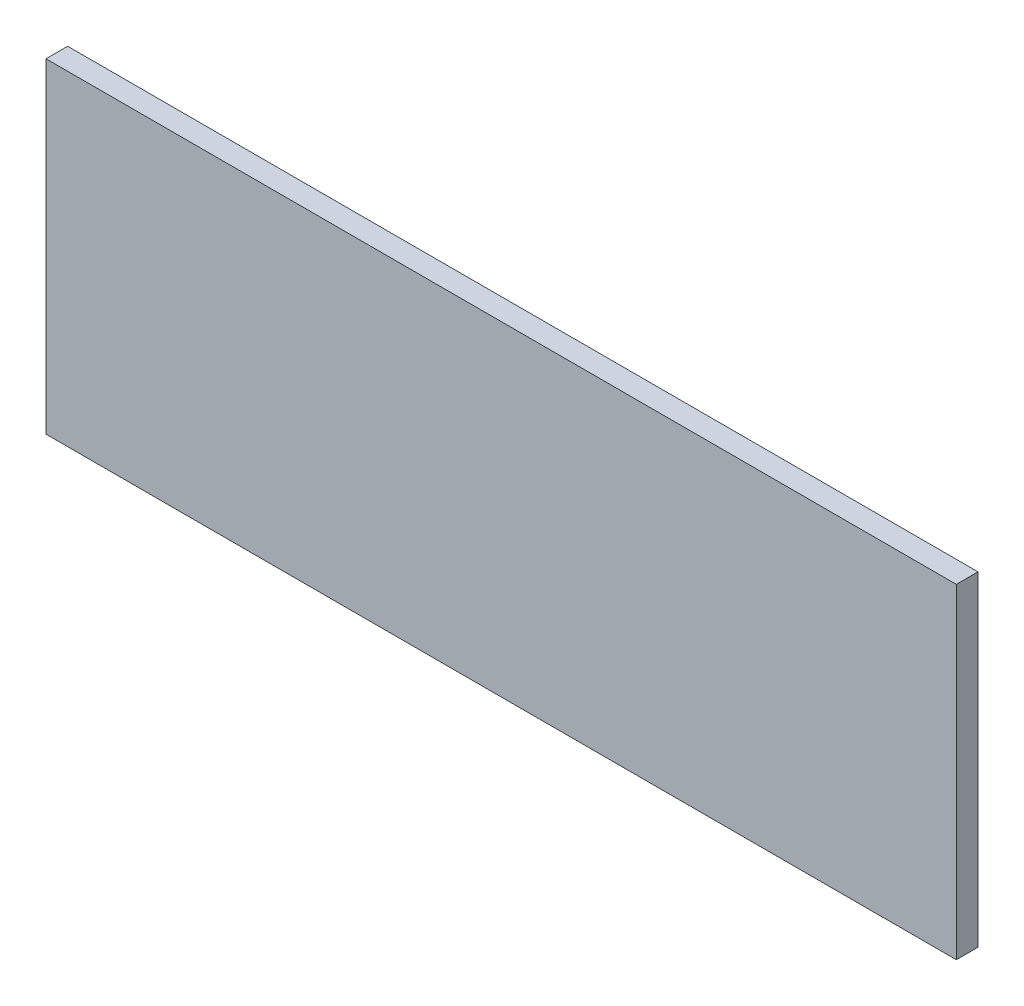
from build123d import *

# Parameters (mm, degrees)
SKETCH_1_W      = 420
SKETCH_1_H      = 150
EXTRUDE_1_DEPTH = 10


with BuildPart() as part:
    # ｽｹｯﾁ1 → ﾎﾞｽ - 押し出し1 (new body)
    with BuildSketch(Plane.XY):
        with Locations((140.719868277, 86.507142857)):
            Rectangle(SKETCH_1_W, SKETCH_1_H)
    extrude(amount=EXTRUDE_1_DEPTH)


solid = part.part
